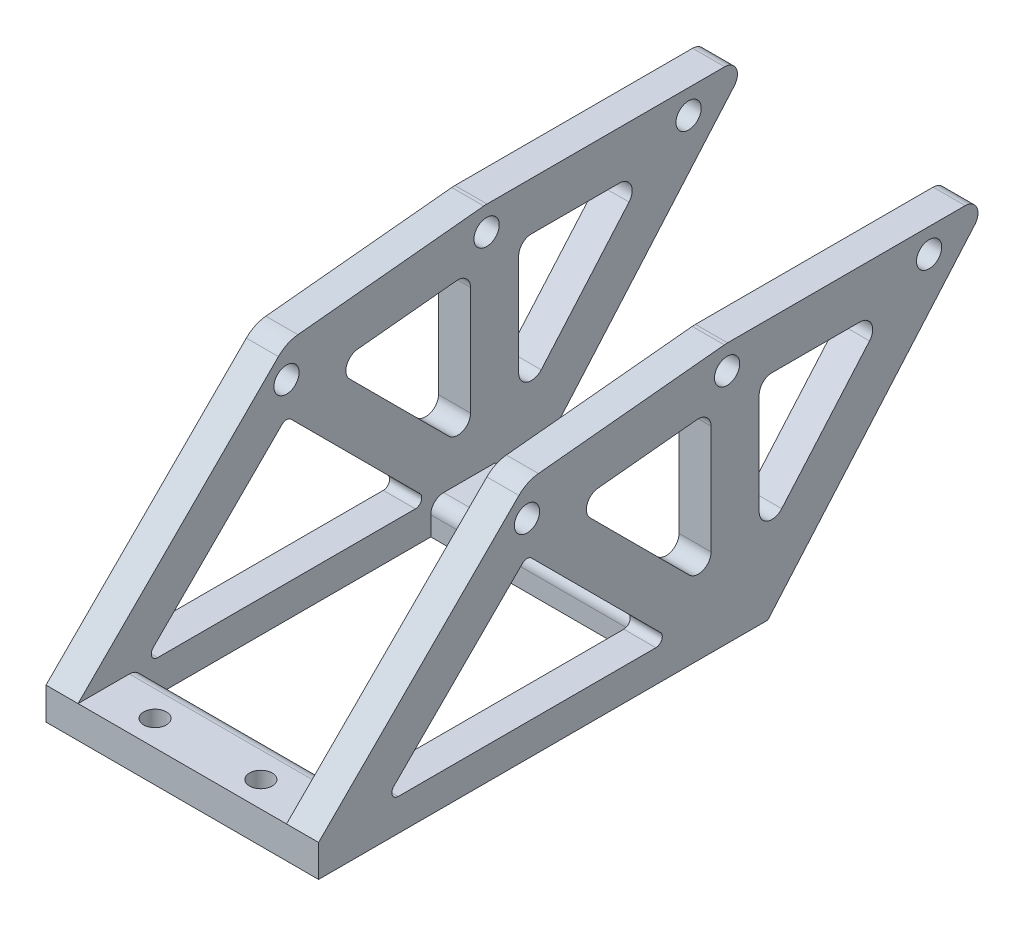
from build123d import *

# Parameters (mm, degrees)
BOSS_EXTRUDE3_DEPTH   = 6.35
SKETCH13_W            = 12.7
SKETCH13_H            = 6.35
BOSS_EXTRUDE4_DEPTH   = 41.275
SKETCH14_W            = 12.7
SKETCH14_H            = 6.35
SKETCH14_W_2          = 69.85
BOSS_EXTRUDE5_DEPTH   = 6.35
CUT_EXTRUDE4_DEPTH    = 107.917859827
CUT_EXTRUDE5_DEPTH    = 107.917859827
SKETCH26_R            = 2.5
BOSS_EXTRUDE6_DEPTH   = 6.35
BOSS_EXTRUDE7_START   = -47.625
SKETCH26_2_R          = 2.5
BOSS_EXTRUDE7_DEPTH   = 6.35
FILLET17_R            = 1.27
FILLET18_R            = 1.27
FILLET19_R            = 1.27
FILLET20_START        = 47.625
FILLET20_DEPTH        = 6.35
FILLET21_R            = 1.27
FILLET22_DEPTH        = 6.35
FILLET29_R            = 2.54
F_8_CLEARANCE_HOLE1_D = 4.4958
FILLET30_R            = 6.35
FILLET31_R            = 2.54


with BuildPart() as part:
    # Sketch4 → Boss-Extrude3 (new body)
    with BuildSketch(Plane(origin=(0, 0, 0), x_dir=(0, 0, -1), z_dir=(1, 0, 0))):
        Polygon((0, 0), (41.275, 41.275), (82.55, 0), (82.55, -6.35), (0, -6.35), align=None)
    extrude(amount=BOSS_EXTRUDE3_DEPTH)

    # Sketch13 → Boss-Extrude4 (add)
    with BuildSketch(Plane(origin=(6.35, 0, 0), x_dir=(0, 0, -1), z_dir=(1, 0, 0))):
        with Locations((6.35, -3.175)):
            Rectangle(SKETCH13_W, SKETCH13_H)
        with Locations((76.2, -3.175)):
            Rectangle(SKETCH13_W, SKETCH13_H)
    extrude(amount=BOSS_EXTRUDE4_DEPTH)

    # Sketch14 → Boss-Extrude5 (add)
    with BuildSketch(Plane(origin=(47.625, 0, 0), x_dir=(0, 0, -1), z_dir=(1, 0, 0))):
        Polygon((41.275, 41.275), (0, 0), (12.7, 0), (82.55, 0), align=None)
        with Locations((6.35, -3.175)):
            Rectangle(SKETCH14_W, SKETCH14_H)
        with Locations((47.625, -3.175)):
            Rectangle(SKETCH14_W_2, SKETCH14_H)
    extrude(amount=BOSS_EXTRUDE5_DEPTH)

    # Sketch20 → Cut-Extrude4 (cut, through all)
    with BuildSketch(Plane(origin=(53.975, 0, 0), x_dir=(0, 0, -1), z_dir=(1, 0, 0))):
        Polygon((41.275, 28.575), (12.7, 0), (69.85, 0), align=None)
    extrude(amount=-CUT_EXTRUDE4_DEPTH, mode=Mode.SUBTRACT)

    # Sketch21 → Cut-Extrude5 (cut, through all)
    with BuildSketch(Plane(origin=(53.975, 0, 0), x_dir=(0, 0, -1), z_dir=(1, 0, 0))):
        with BuildLine():
            ThreePointArc((43.775, 34.925), (43.042766953, 36.692766953), (41.275, 37.425))
            Line((41.275, 37.425), (41.275, 32.425))
            ThreePointArc((41.275, 32.425), (43.042766953, 33.157233047), (43.775, 34.925))
        make_face()
        with BuildLine():
            Line((41.275, 32.425), (41.275, 37.425))
            ThreePointArc((41.275, 37.425), (38.775, 34.925), (41.275, 32.425))
        make_face()
    extrude(amount=-CUT_EXTRUDE5_DEPTH, mode=Mode.SUBTRACT)

    # Sketch26 → Boss-Extrude6 (add)
    with BuildSketch(Plane.ZY):
        Polygon((-41.275, 41.275), (-80.659092999, 45.187499922), (-133.595070682, 45.187499922), (-88.943397116, -6.35), (-77.720070682, -6.35), (-77.720070682, 35.323646113), (-49.981920931, 32.568079069), align=None)
        with Locations((-80.895070682, 40.424999922)):
            Circle(SKETCH26_R, mode=Mode.SUBTRACT)
        with Locations((-120.895070682, 40.424999922)):
            Circle(SKETCH26_R, mode=Mode.SUBTRACT)
        Polygon((-87.245070682, 35.662499922), (-87.245070682, 6.23593212), (-112.740011292, 35.662499922), align=None, mode=Mode.SUBTRACT)
    extrude(amount=-BOSS_EXTRUDE6_DEPTH)

    # Sketch26<2> → Boss-Extrude7 (add)
    with BuildSketch(Plane.ZY.offset(BOSS_EXTRUDE7_START)):
        Polygon((-41.275, 41.275), (-80.659092999, 45.187499922), (-133.595070682, 45.187499922), (-88.943397116, -6.35), (-77.720070682, -6.35), (-77.720070682, 35.323646113), (-49.981920931, 32.568079069), align=None)
        with Locations((-80.895070682, 40.424999922)):
            Circle(SKETCH26_2_R, mode=Mode.SUBTRACT)
        with Locations((-120.895070682, 40.424999922)):
            Circle(SKETCH26_2_R, mode=Mode.SUBTRACT)
        Polygon((-87.245070682, 35.662499922), (-87.245070682, 6.23593212), (-112.740011292, 35.662499922), align=None, mode=Mode.SUBTRACT)
    extrude(amount=-BOSS_EXTRUDE7_DEPTH)

    # Fillet17
    fillet17_edges = [part.edges().sort_by_distance(p)[0] for p in [
        (3.175, 28.575, -41.275),
    ]]
    fillet(fillet17_edges, radius=FILLET17_R)

    # Fillet18
    fillet18_edges = [part.edges().sort_by_distance(p)[0] for p in [
        (50.8, 28.575, -41.275),
    ]]
    fillet(fillet18_edges, radius=FILLET18_R)

    # Fillet19
    # the kernel refuses this fillet: 1.27 mm, written as the material it adds along each edge
    with BuildSketch(Plane(origin=(53.975, 0, -12.7), x_dir=(0, 0.7071067811865481, -0.7071067811865469), z_dir=(-1, 0, 0))) as fillet19_piece_1:
        with BuildLine():
            CenterArc((FILLET19_R * 2.41421356237, FILLET19_R), FILLET19_R, 135, 135)
            Line((FILLET19_R * 1.70710678119, FILLET19_R * 1.70710678119), (0, 0))
            Line((0, 0), (FILLET19_R * 2.41421356237, 0))
        make_face()
    extrude(amount=6.35)

    # Fillet20: read off the stored shape, not the designer's step
    # Fillet20 outline → Fillet20 (add)
    with BuildSketch(Plane.YZ.offset(FILLET20_START)):
        with BuildLine():
            Line((0, -69.85), (2.168025612, -67.681974388))
            ThreePointArc((2.168025612, -67.681974388), (0.783992041, -67.957275782), (0, -66.783948776))
            Line((0, -66.783948776), (0, -69.85))
        make_face()
    extrude(amount=FILLET20_DEPTH)

    # Fillet21
    # the kernel refuses this fillet: 1.27 mm, written as the material it adds along each edge
    with BuildSketch(Plane(origin=(6.35, 0, -69.85), x_dir=(0, 0, 1), z_dir=(-1, 0, 0))) as fillet21_piece_1:
        with BuildLine():
            CenterArc((FILLET21_R * 2.41421356237, FILLET21_R), FILLET21_R, 135, 135)
            Line((FILLET21_R * 1.70710678119, FILLET21_R * 1.70710678119), (0, 0))
            Line((0, 0), (FILLET21_R * 2.41421356237, 0))
        make_face()
    extrude(amount=6.35)

    # Fillet22: read off the stored shape, not the designer's step
    # Fillet22 outline → Fillet22 (add)
    with BuildSketch(Plane.YZ):
        with BuildLine():
            ThreePointArc((0, -15.766051224), (0.783992041, -14.592724218), (2.168025612, -14.868025612))
            Line((2.168025612, -14.868025612), (0, -12.7))
            Line((0, -12.7), (0, -15.766051224))
        make_face()
    extrude(amount=FILLET22_DEPTH)

    # Fillet29
    fillet29_edges = [part.edges().sort_by_distance(p)[0] for p in [
        (26.9875, 0, -12.7),
        (26.9875, 0, -69.85),
    ]]
    fillet(fillet29_edges, radius=FILLET29_R)

    # #8 Clearance Hole1 (through all)
    with Locations(Plane(origin=(0, 0, 0), x_dir=(1, 0, 0), z_dir=(0, 1, 0))):
        with Locations((16.51, 77.47), (37.465, 77.47), (37.465, 5.08), (16.51, 5.08)):
            Hole(F_8_CLEARANCE_HOLE1_D / 2)

    # Fillet30
    # the kernel refuses this fillet: 6.35 mm, written as the material it takes off along each edge
    with BuildSketch(Plane(origin=(-0.786592277, 45.187499922, -80.659092999), x_dir=(0, -0.0988555378398254, 0.995101795113645), z_dir=(1, 0, 0))) as fillet30_piece_1:
        with BuildLine():
            CenterArc((FILLET30_R * 0.0495491197902, FILLET30_R), FILLET30_R, 264.326728924, 5.673271076)
            Line((-FILLET30_R * 0.0493064180496, FILLET30_R * 0.00489820488635), (0, 0))
            Line((0, 0), (FILLET30_R * 0.0495491197903, 0))
        make_face()
    extrude(amount=7.923184553, mode=Mode.SUBTRACT)
    with BuildSketch(Plane(origin=(46.838407723, 45.187499922, -80.659092999), x_dir=(0, 0, -1), z_dir=(1, 0, 0))) as fillet30_piece_2:
        with BuildLine():
            CenterArc((FILLET30_R * 0.0495491197903, -FILLET30_R), FILLET30_R, 90, 5.673271076)
            Line((-FILLET30_R * 0.0493064180496, -FILLET30_R * 0.00489820488636), (0, 0))
            Line((0, 0), (FILLET30_R * 0.0495491197903, 0))
        make_face()
    extrude(amount=7.923184553, mode=Mode.SUBTRACT)
    with BuildSketch(Plane(origin=(41.952376432, 41.275, -41.275), x_dir=(0, -0.7071067811865476, 0.7071067811865476), z_dir=(1, 0, 0)), Plane(origin=(-5.672623568, 41.275, -41.275), x_dir=(0, -0.7071067811865459, 0.707106781186549), z_dir=(1, 0, 0))) as fillet30_piece_3:
        with BuildLine():
            CenterArc((FILLET30_R * 0.357330618477, FILLET30_R), FILLET30_R, 230.673271076, 39.326728924)
            Line((-FILLET30_R * 0.276411187654, FILLET30_R * 0.22645535154), (0, 0))
            Line((0, 0), (FILLET30_R * 0.357330618477, 0))
        make_face()
    extrude(amount=17.695247137, mode=Mode.SUBTRACT)

    # Fillet31
    fillet31_edges = [part.edges().sort_by_distance(p)[0] for p in [
        (3.175, 35.323646113, -77.720070682),
        (3.175, 32.568079069, -49.981920931),
        (3.175, 4.829929318, -77.720070682),
        (3.175, 45.187499922, -133.595070682),
        (3.175, 35.662499922, -87.245070682),
        (3.175, 6.23593212, -87.245070682),
        (3.175, 35.662499922, -112.740011292),
        (50.8, 4.829929318, -77.720070682),
        (50.8, 35.323646113, -77.720070682),
        (50.8, 32.568079069, -49.981920931),
        (50.8, 45.187499922, -133.595070682),
        (50.8, 35.662499922, -87.245070682),
        (50.8, 35.662499922, -112.740011292),
        (50.8, 6.23593212, -87.245070682),
    ]]
    fillet(fillet31_edges, radius=FILLET31_R)


solid = part.part
